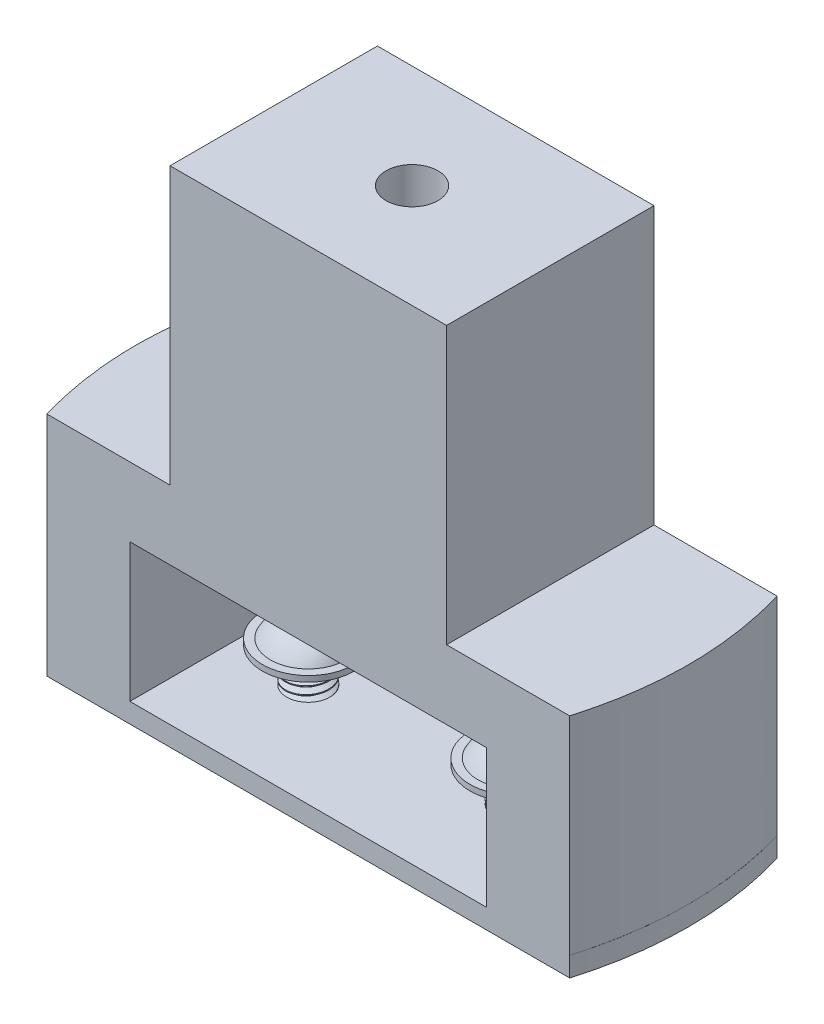
from build123d import *

# Parameters (mm, degrees)
SKETCH1_R           = 3.96875
BOSS_EXTRUDE1_DEPTH = 17.4625
CUT_SWEEP1_PITCH    = 1.411111111
SKETCH4_OUTSIDE_W   = 16.912
SKETCH4_OUTSIDE_H   = 16.912
SKETCH4_OUTSIDE_R   = 2.899449189
CUT_EXTRUDE1_DEPTH  = 1.411111111
CUT_EXTRUDE1_DRAFT  = -45
CUT_EXTRUDE2_DEPTH  = 2.8575
BOSS_EXTRUDE2_START = -6.35
SKETCH8_R           = 3.96875
BOSS_EXTRUDE2_DEPTH = 3.6068
BOSS_EXTRUDE4_DEPTH = 25.4
BOSS_EXTRUDE5_DEPTH = 12.7
BOSS_EXTRUDE6_DEPTH = 50.8
SKETCH9_R           = 4.5593
SKETCH9_R_2         = 3.96875
BOSS_EXTRUDE3_DEPTH = 2.032
SKETCH14_R          = 4.7625
CUT_EXTRUDE4_DEPTH  = 38.1


with BuildPart() as part:
    # Sketch1 → Boss-Extrude1 (new body)
    with BuildSketch(Plane(origin=(0, 0, 0), x_dir=(1, 0, 0), z_dir=(0, 1, 0))):
        with Locations(Location((-19.05, 0, 0), (0, 0, 270))):
            Circle(SKETCH1_R)
    extrude(amount=-BOSS_EXTRUDE1_DEPTH)

    # Cut-Sweep1: the profile of Sketch3 screwed along a right-hand helix of 13.375 turns, 8 arcs to a turn; built about Z, then put on its axis
    cut_sweep1_z = Axis((0, 0, 0), (0, 0, 1))
    cut_sweep1_corners = [(3.052206448, 0, -0.529166667), (4.045128629, 0, 0.044097222), (4.045128629, 0, -1.278819444), (3.052206448, 0, -0.705555556)]
    with BuildLine(mode=Mode.PRIVATE) as cut_sweep1_profile:
        Line(cut_sweep1_corners[0], cut_sweep1_corners[1])
        Line(cut_sweep1_corners[1], cut_sweep1_corners[2])
        Line(cut_sweep1_corners[2], cut_sweep1_corners[3])
        Line(cut_sweep1_corners[3], cut_sweep1_corners[0])
    cut_sweep1_cap = Face(cut_sweep1_profile.wire())
    cut_sweep1_turn_angles = [0, 22.5, 45, 67.5, 90, 112.5, 135, 157.5, 180, 202.5, 225, 247.5, 270, 292.5, 315, 337.5, 360]
    cut_sweep1_turn_weights = [1, 0.9238795325112867, 1, 0.9238795325112867, 1, 0.9238795325112867, 1, 0.9238795325112867, 1, 0.9238795325112867, 1, 0.9238795325112867, 1, 0.9238795325112867, 1, 0.9238795325112867, 1]
    cut_sweep1_turn_rails = [Edge.make_bspline([Vector(p[0], p[1], 0).rotate(cut_sweep1_z, cut_sweep1_turn_angles[k]) / cut_sweep1_turn_weights[k] + Vector(0, 0, p[2] + CUT_SWEEP1_PITCH * cut_sweep1_turn_angles[k] / 360) for k in range(17)], [0, 0, 0, 1, 1, 2, 2, 3, 3, 4, 4, 5, 5, 6, 6, 7, 7, 8, 8, 8], 2, cut_sweep1_turn_weights) for p in cut_sweep1_corners]
    cut_sweep1_turn_sides = [Face.make_surface_from_curves(cut_sweep1_turn_rails[p[0]], cut_sweep1_turn_rails[p[1]]) for p in [(0, 1), (1, 2), (2, 3), (3, 0)]]
    cut_sweep1_last_angles = [4680, 4702.5, 4725, 4747.5, 4770, 4792.5, 4815]
    cut_sweep1_last_weights = [1, 0.9238795325112867, 1, 0.9238795325112867, 1, 0.9238795325112594, 1]
    cut_sweep1_last_rails = [Edge.make_bspline([Vector(p[0], p[1], 0).rotate(cut_sweep1_z, cut_sweep1_last_angles[k]) / cut_sweep1_last_weights[k] + Vector(0, 0, p[2] + CUT_SWEEP1_PITCH * cut_sweep1_last_angles[k] / 360) for k in range(7)], [0, 0, 0, 1, 1, 2, 2, 3, 3, 3], 2, cut_sweep1_last_weights) for p in cut_sweep1_corners]
    cut_sweep1_last_sides = [Face.make_surface_from_curves(cut_sweep1_last_rails[p[0]], cut_sweep1_last_rails[p[1]]) for p in [(0, 1), (1, 2), (2, 3), (3, 0)]]
    cut_sweep1 = Plane(origin=(-19.05, -17.4625, 0), x_dir=(0, 0, -1), z_dir=(0, 1, 0)) * Solid(Shell([*[p.moved(Location((0, 0, CUT_SWEEP1_PITCH * i))) for i in range(13) for p in cut_sweep1_turn_sides], *cut_sweep1_last_sides, cut_sweep1_cap, cut_sweep1_cap.rotate(cut_sweep1_z, 4815).moved(Location((0, 0, CUT_SWEEP1_PITCH * 4815 / 360)))]))
    add(cut_sweep1, mode=Mode.SUBTRACT)


with BuildPart() as cut_extrude1_tool:
    # Sketch4 outside → Cut-Extrude1 (with draft: the straight prism first)
    with BuildSketch(Plane.XZ.offset(17.4625)):
        with Locations((-19.05, 0)):
            Rectangle(SKETCH4_OUTSIDE_W, SKETCH4_OUTSIDE_H)
        with Locations((-19.05, 0)):
            Circle(SKETCH4_OUTSIDE_R, mode=Mode.SUBTRACT)
    extrude(amount=-CUT_EXTRUDE1_DEPTH)
    # Cut-Extrude1: the draft: its side faces are tilted about the plane it starts from
    cut_extrude1_sides = [cut_extrude1_tool.faces().sort_by_distance(p)[0] for p in [
        (-19.05, -16.756944444, -8.456),
        (-10.594, -16.756944444, 0),
        (-19.05, -16.756944444, 8.456),
        (-27.506, -16.756944444, 0),
        (-21.949449189, -16.756944444, 0),
    ]]
    draft(cut_extrude1_sides, Plane.XZ.offset(17.4625), CUT_EXTRUDE1_DRAFT)


with BuildPart() as part_1:
    add(part.part)

    # Cut-Extrude1: cut by cut_extrude1_tool
    add(cut_extrude1_tool.part, mode=Mode.SUBTRACT)

    # Sketch5 → Revolve1 (revolve)
    with BuildSketch(Plane.XY, mode=Mode.PRIVATE) as revolve1_sk:
        with BuildLine():
            Line((-19.05, 0), (-19.05, 4.2164))
            Line((-19.05, 4.2164), (-23.01875, 4.2164))
            ThreePointArc((-23.01875, 4.2164), (-24.732243312, 2.846599775), (-25.9969, 1.0541))
            Line((-25.9969, 1.0541), (-27.4701, 1.0541))
            Line((-27.4701, 1.0541), (-27.4701, 0))
            Line((-27.4701, 0), (-19.05, 0))
        make_face()
    revolve(revolve1_sk.sketch.rotate(Axis((-19.05, 0, 0), (0, 1, 0)), 270), axis=Axis((-19.05, 0, 0), (0, 1, 0)))

    # Sketch6 → Cut-Extrude2 (cut)
    with BuildSketch(Plane(origin=(0, 4.2164, 0), x_dir=(1, 0, 0), z_dir=(0, 1, 0))):
        Polygon((-19.05, 2.749630657), (-21.43125, 1.374815329), (-21.43125, -1.374815329), (-19.05, -2.749630657), (-16.66875, -1.374815329), (-16.66875, 1.374815329), align=None)
    extrude(amount=-CUT_EXTRUDE2_DEPTH, mode=Mode.SUBTRACT)

    # Cut-Extrude3 cone 1 section (through the dimple's axis) → Cut-Extrude3 (revolve, cut)
    with BuildSketch(Plane(origin=(-19.05, 4.2164, 0), x_dir=(0, 0, 1), z_dir=(1, 0, 0))):
        Polygon((0, 0), (2.749630657, 0), (0, 2.749630657), align=None)
    revolve(axis=Axis((-19.05, 4.2164, 0), (0, -1, 0)), mode=Mode.SUBTRACT)


with BuildPart() as body_2:
    # Body-Move/Copy1: copy of part
    add(part_1.part.moved(Location((38.1, 0, 0))))


with BuildPart() as body_3:
    # Sketch8 → Boss-Extrude2 (new body)
    with BuildSketch(Plane(origin=(0, 0, 0), x_dir=(1, 0, 0), z_dir=(0, 1, 0)).offset(BOSS_EXTRUDE2_START)):
        with BuildLine():
            Line((-48.013934322, 19.05), (48.013934322, 19.05))
            ThreePointArc((48.013934322, 19.05), (50.8, 0), (48.013934322, -19.05))
            Line((48.013934322, -19.05), (-48.013934322, -19.05))
            ThreePointArc((-48.013934322, -19.05), (-50.8, 0), (-48.013934322, 19.05))
        make_face()
        with Locations(Location((19.05, 0, 0), (0, 0, 270))):
            Circle(SKETCH8_R, mode=Mode.SUBTRACT)
        with Locations(Location((-19.05, 0, 0), (0, 0, 270))):
            Circle(SKETCH8_R, mode=Mode.SUBTRACT)
    extrude(amount=-BOSS_EXTRUDE2_DEPTH)


with BuildPart() as boss_extrude4_tool:
    # Sketch10 → Boss-Extrude4 (new body)
    with BuildSketch(Plane(origin=(0, -6.35, 0), x_dir=(1, 0, 0), z_dir=(0, 1, 0))):
        with BuildLine():
            Line((-48.013934322, 19.05), (-32.773934322, 19.05))
            Line((-32.773934322, 19.05), (-32.773934322, -19.05))
            Line((-32.773934322, -19.05), (-48.013934322, -19.05))
            add(Edge.make_bspline(
                [(-48.013934322, 19.05), (-53.586065678, 0), (-48.013934322, -19.05)],
                knots=[0, 0, 0, 1, 1, 1], degree=2))
        make_face()
        with BuildLine():
            Line((48.013934322, 19.05), (32.773934322, 19.05))
            Line((32.773934322, 19.05), (32.773934322, -19.05))
            Line((32.773934322, -19.05), (48.013934322, -19.05))
            add(Edge.make_bspline(
                [(48.013934322, -19.05), (53.586065678, 0), (48.013934322, 19.05)],
                knots=[0, 0, 0, 1, 1, 1], degree=2))
        make_face()
    extrude(amount=BOSS_EXTRUDE4_DEPTH)


with BuildPart() as body_3_1:
    add(body_3.part)


with BuildPart() as body_3_2:
    # Boss-Extrude4: joined with boss_extrude4_tool
    add(body_3_1.part.fuse(boss_extrude4_tool.part, tol=0.00001))

    # Sketch11 → Boss-Extrude5 (add)
    with BuildSketch(Plane(origin=(0, 19.05, 0), x_dir=(1, 0, 0), z_dir=(0, 1, 0))):
        with BuildLine():
            Line((-48.013934322, 19.05), (48.013934322, 19.05))
            add(Edge.make_bspline(
                [(48.013934322, 19.05), (53.586065678, 0), (48.013934322, -19.05)],
                knots=[0, 0, 0, 1, 1, 1], degree=2))
            Line((48.013934322, -19.05), (-48.013934322, -19.05))
            add(Edge.make_bspline(
                [(-48.013934322, 19.05), (-53.586065678, 0), (-48.013934322, -19.05)],
                knots=[0, 0, 0, 1, 1, 1], degree=2))
        make_face()
    extrude(amount=BOSS_EXTRUDE5_DEPTH)

    # Sketch12 → Boss-Extrude6 (add)
    with BuildSketch(Plane(origin=(0, 31.75, 0), x_dir=(1, 0, 0), z_dir=(0, 1, 0))):
        Polygon((0, 19.05), (25.4, 19.05), (25.4, -19.05), (-25.4, -19.05), (-25.4, 19.05), align=None)
    extrude(amount=BOSS_EXTRUDE6_DEPTH)

    # Sketch9 → Boss-Extrude3 (add)
    # profile 1 of 2: a face of its own
    with BuildSketch(Plane.XZ.offset(9.9568)):
        with Locations(Location((-19.05, 0, 0), (0, 0, 90))):
            Circle(SKETCH9_R)
        with Locations(Location((-19.05, 0, 0), (0, 0, 90))):
            Circle(SKETCH9_R_2, mode=Mode.SUBTRACT)
    # profile 2 of 2: a face of its own
    with BuildSketch(Plane.XZ.offset(9.9568)):
        with Locations(Location((19.05, 0, 0), (0, 0, 90))):
            Circle(SKETCH9_R)
        with Locations(Location((19.05, 0, 0), (0, 0, 90))):
            Circle(SKETCH9_R_2, mode=Mode.SUBTRACT)
    extrude(amount=BOSS_EXTRUDE3_DEPTH)

    # Sketch14 → Cut-Extrude4 (cut)
    with BuildSketch(Plane(origin=(0, 82.55, 0), x_dir=(1, 0, 0), z_dir=(0, 1, 0))):
        with Locations(Location((0, 0, 0), (0, 0, 270))):
            Circle(SKETCH14_R)
    extrude(amount=-CUT_EXTRUDE4_DEPTH, mode=Mode.SUBTRACT)


solid = Compound([part_1.part, body_2.part, body_3_2.part])
